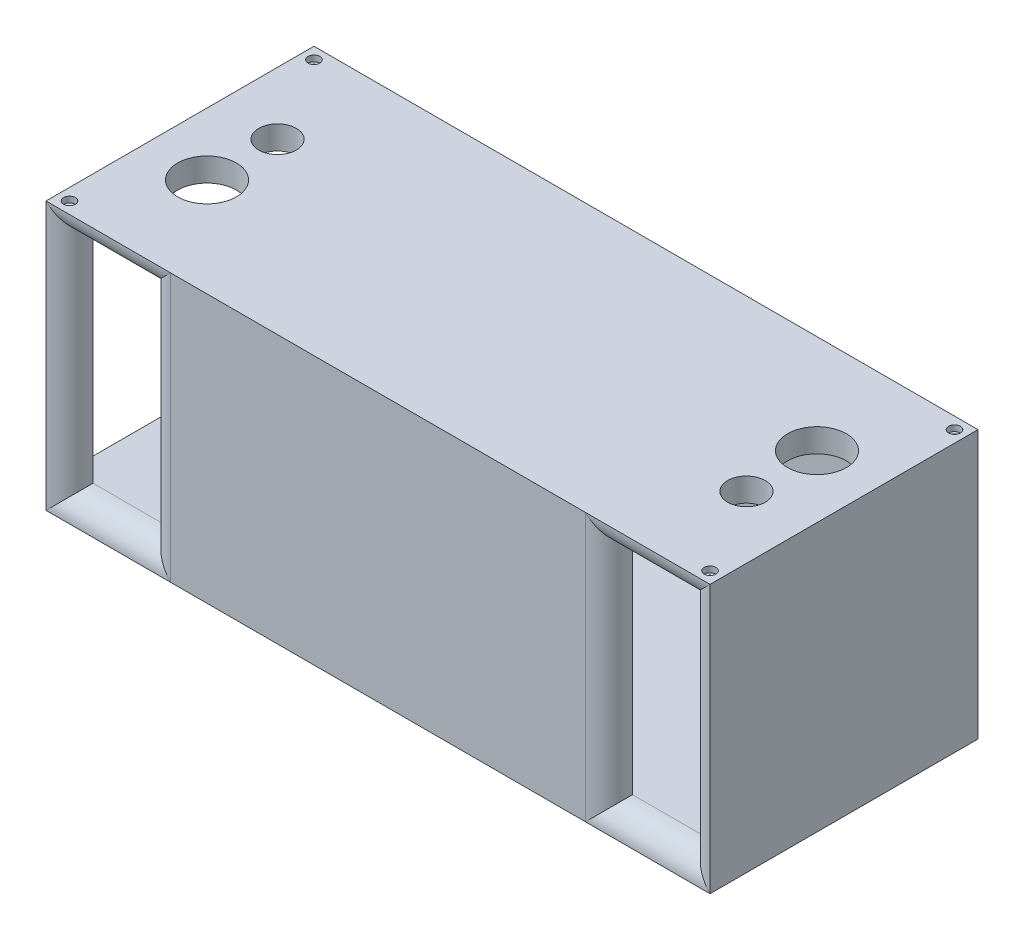
from build123d import *

# Parameters (mm, degrees)
SKETCH1_W           = 282.5
SKETCH1_H           = 114
BOSS_EXTRUDE1_DEPTH = 114
SKETCH5_W           = 33
SKETCH5_H           = 94
CUT_EXTRUDE3_DEPTH  = 326.266429255
SKETCH6_W           = 94
SKETCH6_H           = 94
CUT_EXTRUDE4_DEPTH  = 262
SKETCH7_R           = 1.25
CUT_EXTRUDE5_DEPTH  = 262
SKETCH8_R           = 2.5
CUT_EXTRUDE6_DEPTH  = 2.5
FILLET3_R           = 10
FILLET4_R           = 10
FILLET6_R           = 10
SKETCH11_R          = 8
SKETCH11_R_2        = 12.5
CUT_EXTRUDE7_DEPTH  = 10


with BuildPart() as part:
    # Sketch1 → Boss-Extrude1 (new body)
    with BuildSketch(Plane.XY):
        with Locations((-141.25, 57)):
            Rectangle(SKETCH1_W, SKETCH1_H)
    extrude(amount=BOSS_EXTRUDE1_DEPTH)

    # Sketch5 → Cut-Extrude3 (cut, through all)
    with BuildSketch(Plane.XY):
        with Locations((-256, 57)):
            Rectangle(SKETCH5_W, SKETCH5_H)
        with Locations((-26.5, 57)):
            Rectangle(SKETCH5_W, SKETCH5_H)
    extrude(amount=CUT_EXTRUDE3_DEPTH, mode=Mode.SUBTRACT)

    # Sketch6 → Cut-Extrude4 (cut)
    with BuildSketch(Plane.ZY.offset(282.5)):
        with Locations((57, 57)):
            Rectangle(SKETCH6_W, SKETCH6_H)
    extrude(amount=-CUT_EXTRUDE4_DEPTH, mode=Mode.SUBTRACT)

    # Sketch7 → Cut-Extrude5 (cut)
    with BuildSketch(Plane(origin=(0, 114, 0), x_dir=(1, 0, 0), z_dir=(0, 1, 0))):
        with Locations(Location((-277.5, -109, 0), (0, 0, 180))):
            Circle(SKETCH7_R)
        with Locations(Location((-277.5, -5, 0), (0, 0, 180))):
            Circle(SKETCH7_R)
        with Locations(Location((-5, -109, 0), (0, 0, 180))):
            Circle(SKETCH7_R)
        with Locations(Location((-5, -5, 0), (0, 0, 180))):
            Circle(SKETCH7_R)
    extrude(amount=-CUT_EXTRUDE5_DEPTH, mode=Mode.SUBTRACT)

    # Sketch8 → Cut-Extrude6 (cut)
    with BuildSketch(Plane(origin=(0, 114, 0), x_dir=(1, 0, 0), z_dir=(0, 1, 0))):
        with Locations(Location((-277.5, -5, 0), (0, 0, 180))):
            Circle(SKETCH8_R)
        with Locations((-277.5, -109)):
            Circle(SKETCH8_R)
        with Locations((-5, -5)):
            Circle(SKETCH8_R)
        with Locations(Location((-5, -109, 0), (0, 0, 180))):
            Circle(SKETCH8_R)
    extrude(amount=-CUT_EXTRUDE6_DEPTH, mode=Mode.SUBTRACT)

    # Fillet3
    fillet3_edges = [part.edges().sort_by_distance(p)[0] for p in [
        (-256, 104, 114),
    ]]
    fillet(fillet3_edges, radius=FILLET3_R - 0.0001)  # a hair under: the kernel refuses the full size

    # Fillet4
    fillet4_edges = [part.edges().sort_by_distance(p)[0] for p in [
        (-239.5, 61.99995, 114),
        (-272.5, 61.99995, 114),
        (-256, 10, 114),
    ]]
    fillet(fillet4_edges, radius=FILLET4_R - 0.0001)  # a hair under: the kernel refuses the full size

    # Fillet6
    fillet6_edges = [part.edges().sort_by_distance(p)[0] for p in [
        (-256, 104, 0),
        (-239.5, 57, 0),
        (-272.5, 57, 0),
        (-256, 10, 0),
        (-26.5, 10, 0),
        (-10, 57, 0),
        (-43, 57, 0),
        (-26.5, 104, 0),
        (-26.5, 10, 114),
        (-26.5, 104, 114),
        (-10, 57, 114),
        (-43, 57, 114),
    ]]
    fillet(fillet6_edges, radius=FILLET6_R - 0.0001)  # a hair under: the kernel refuses the full size

    # Sketch11 → Cut-Extrude7 (cut)
    with BuildSketch(Plane(origin=(0, 114, 0), x_dir=(1, 0, 0), z_dir=(0, 1, 0))):
        with Locations(Location((-256, -42, 0), (0, 0, 180))):
            Circle(SKETCH11_R)
        with Locations(Location((-256, -72, 0), (0, 0, 180))):
            Circle(SKETCH11_R_2)
        with Locations(Location((-26.5, -42, 0), (0, 0, 180))):
            Circle(SKETCH11_R_2)
        with Locations(Location((-26.5, -72, 0), (0, 0, 180))):
            Circle(SKETCH11_R)
    extrude(amount=-CUT_EXTRUDE7_DEPTH, mode=Mode.SUBTRACT)


solid = part.part
